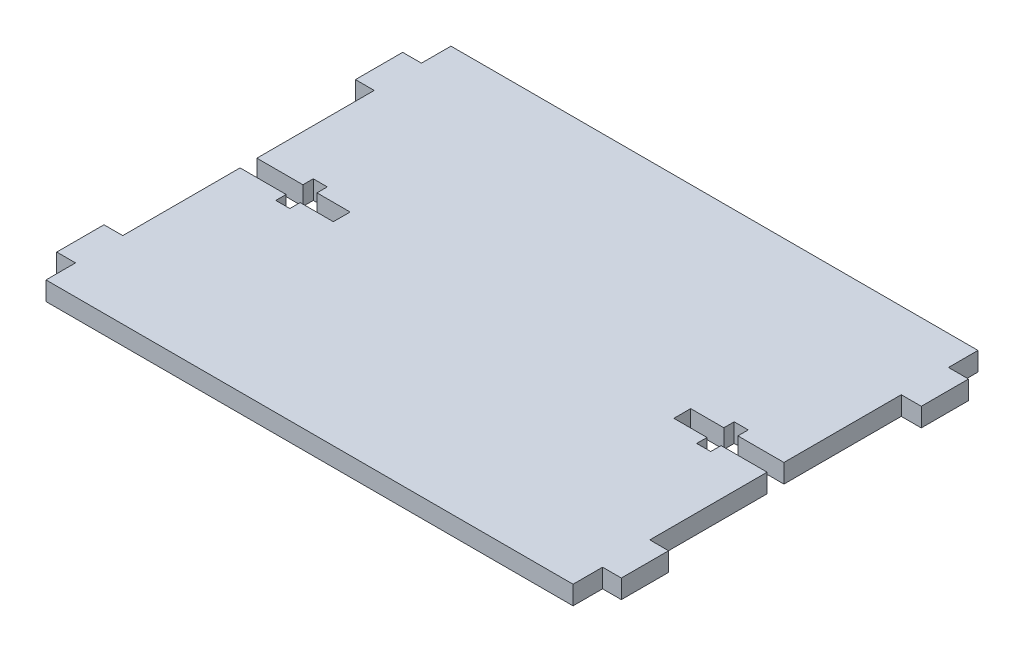
from build123d import *

# Parameters (mm, degrees)
BOSS_EXTRUDE1_DEPTH = 3.18
CUT_EXTRUDE1_DEPTH  = 71.221642989


with BuildPart() as part:
    # Sketch1 → Boss-Extrude1 (new body)
    with BuildSketch(Plane(origin=(0, 0, 0), x_dir=(1, 0, 0), z_dir=(0, 1, 0))):
        Polygon((44.64191244, 12.475260069), (44.64191244, 17.475260069), (-44.64191244, 17.475260069), (-44.64191244, 12.475260069), (-47.82191244, 12.475260069), (-47.82191244, 4.475260069), (-44.64191244, 4.475260069), (-44.64191244, -38.124739931), (-47.82191244, -38.124739931), (-47.82191244, -46.124739931), (-44.64191244, -46.124739931), (-44.64191244, -51.124739931), (44.64191244, -51.124739931), (44.64191244, -46.124739931), (47.82191244, -46.124739931), (47.82191244, -38.124739931), (44.64191244, -38.124739931), (44.64191244, 4.475260069), (48.033610223, 4.475260069), (48.033610223, 12.475260069), align=None)
    extrude(amount=BOSS_EXTRUDE1_DEPTH)

    # Sketch2 → Cut-Extrude1 (cut, through all)
    with BuildSketch(Plane(origin=(0, 3.18, 0), x_dir=(1, 0, 0), z_dir=(0, 1, 0))):
        Polygon((-44.64191244, -15.399739931), (-36.84191244, -15.399739931), (-36.84191244, -13.649739931), (-34.46191244, -13.649739931), (-34.46191244, -15.399739931), (-28.84191244, -15.399739931), (-28.84191244, -18.249739931), (-34.46191244, -18.249739931), (-34.46191244, -19.999739931), (-36.84191244, -19.999739931), (-36.84191244, -18.249739931), (-44.64191244, -18.249739931), align=None)
    cut_extrude1 = extrude(amount=-CUT_EXTRUDE1_DEPTH, mode=Mode.SUBTRACT)

    # Mirror1: Cut-Extrude1 across plane
    add(cut_extrude1.mirror(Plane(origin=(0, 0, 0), x_dir=(0, 0, 1), z_dir=(1, 0, 0))), mode=Mode.SUBTRACT)


solid = part.part
